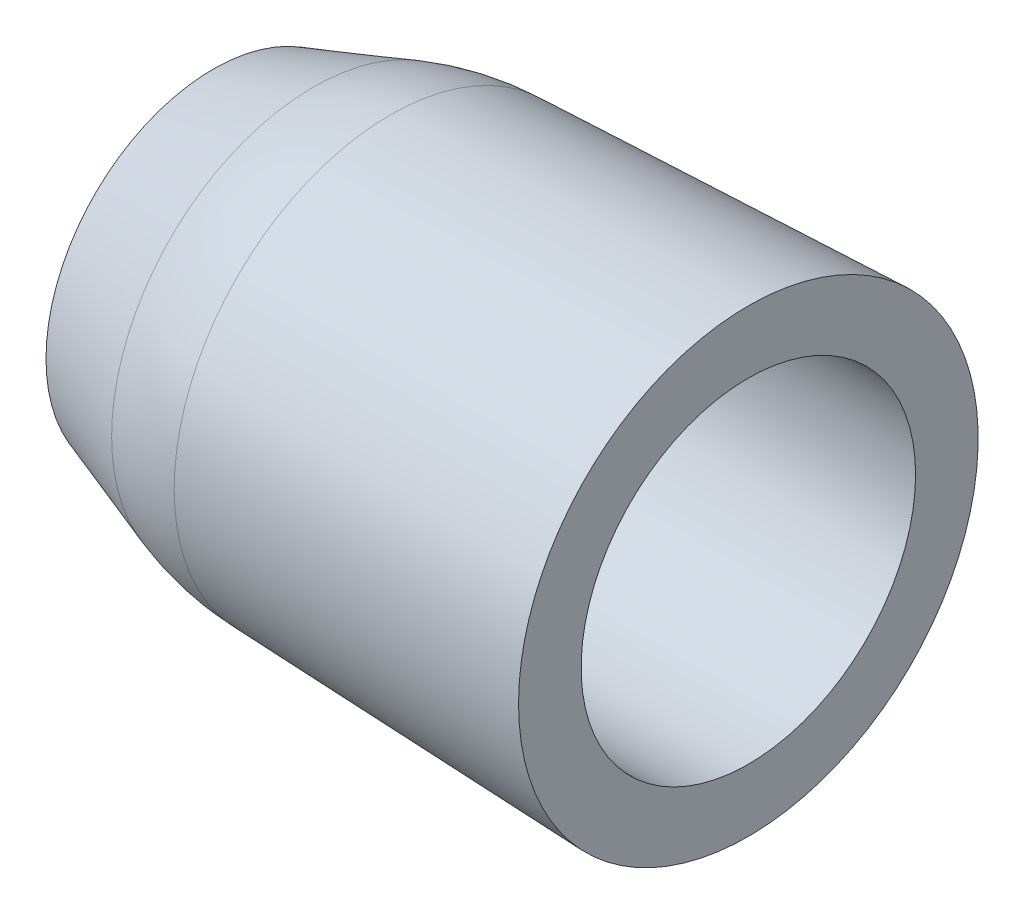
from build123d import *

# Parameters (mm, degrees)
SKETCH3_R          = 7.9375
CUT_EXTRUDE1_DEPTH = 25.146
FILLET1_R          = 12.7


with BuildPart() as part:
    # Sketch2 → Revolve1 (revolve)
    with BuildSketch(Plane.XY):
        Polygon((-2.409498475, 0), (-2.409498475, 10.907816429), (-21.2812055, 10.186700377), (-27.809498475, 7.9375), (-27.809498475, 0), align=None)
    revolve(axis=Axis((-27.809498475, 0, 0), (1, 0, 0)))

    # Sketch3 → Cut-Extrude1 (cut)
    with BuildSketch(Plane(origin=(-2.409498475, 0, 0), x_dir=(0, 0, -1), z_dir=(1, 0, 0))):
        Circle(SKETCH3_R)
    extrude(amount=-CUT_EXTRUDE1_DEPTH, mode=Mode.SUBTRACT)

    # Fillet1
    fillet1_edges = [part.edges().sort_by_distance(p)[0] for p in [
        (-21.2812055, -10.186700377, 0),
    ]]
    fillet(fillet1_edges, radius=FILLET1_R)


solid = part.part
